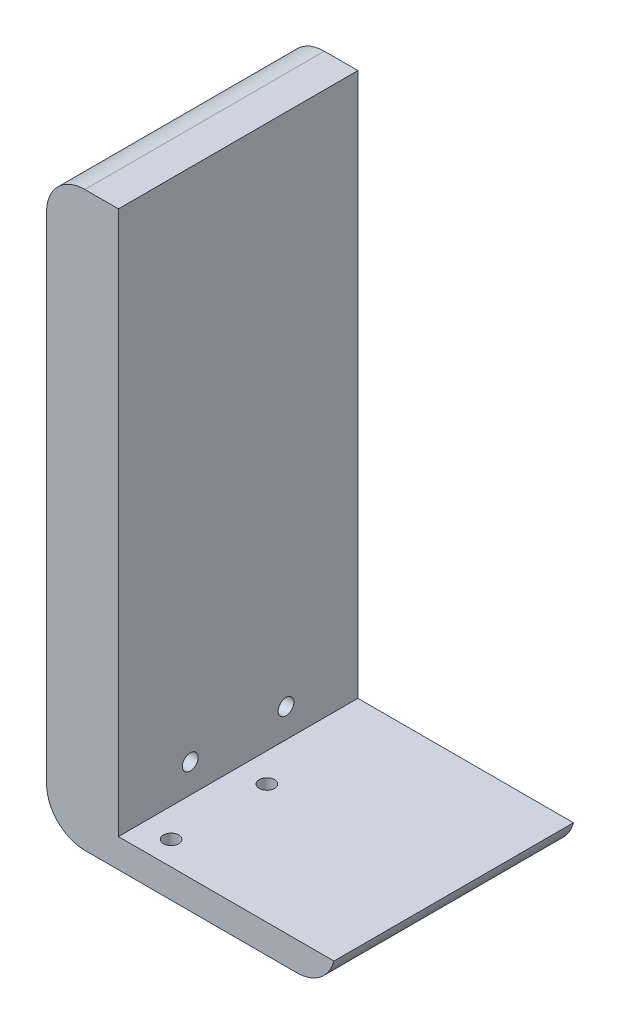
from build123d import *

# Parameters (mm, degrees)
EXTRUDE_1_DEPTH     = 25
FILLET_1_R          = 8
SKETCH_2_R          = 1.65
CUT_EXTRUDE_1_DEPTH = 137.034003102
SKETCH_3_R          = 1.6
CUT_EXTRUDE_2_DEPTH = 131.794686436


with BuildPart() as part:
    # 草图1 → 凸台-拉伸1 (new, symmetric)
    with BuildSketch(Plane.XY):
        Polygon((0, 0), (0, 119.5), (15, 119.5), (15, 6), (60, 6), (60, 0), align=None)
    extrude(amount=EXTRUDE_1_DEPTH, both=True)

    # 圆角1
    # the kernel refuses this fillet: 8 mm, written as the material it takes off along each edge
    with BuildSketch(Plane(origin=(0, 119.5, 45), x_dir=(0, -1, 0), z_dir=(0, 0, -1)), Plane(origin=(0, 0, -45), x_dir=(0, 1, 0), z_dir=(0, 0, 1))) as fillet_1_piece_1:
        with BuildLine():
            CenterArc((FILLET_1_R, -FILLET_1_R), FILLET_1_R, 90, 90)
            Line((0, -FILLET_1_R), (-FILLET_1_R * 0.02, -FILLET_1_R))
            Line((-FILLET_1_R * 0.02, -FILLET_1_R), (-FILLET_1_R * 0.02, FILLET_1_R * 0.02))
            Line((-FILLET_1_R * 0.02, FILLET_1_R * 0.02), (FILLET_1_R, FILLET_1_R * 0.02))
            Line((FILLET_1_R, FILLET_1_R * 0.02), (FILLET_1_R, 0))
        make_face()
    extrude(amount=90, mode=Mode.SUBTRACT)
    with BuildSketch(Plane(origin=(60, 0, -44.364916731), x_dir=(0, 1, 0), z_dir=(0, 0, 1))) as fillet_1_piece_2:
        with BuildLine():
            CenterArc((8, 7.745966692), FILLET_1_R, 180, 75.522487814)
            Line((0, 7.745966692), (-0.16, 7.745966692))
            Line((-0.16, 7.745966692), (-0.16, 0))
            Line((-0.16, 0), (0, -0.16))
            ThreePointArc((0, -0.16), (3, -0.16), (5.96, -0.154919334))
            Line((5.96, -0.154919334), (6, 0))
        make_face()
    extrude(amount=88.729833462, mode=Mode.SUBTRACT)

    # 草图2 → 切除-拉伸1 (cut, through all)
    with BuildSketch(Plane.ZY):
        with Locations((10, 12)):
            Circle(SKETCH_2_R)
        with Locations((-10, 12)):
            Circle(SKETCH_2_R)
    extrude(amount=-CUT_EXTRUDE_1_DEPTH, mode=Mode.SUBTRACT)

    # 草图3 → 切除-拉伸2 (cut, through all)
    with BuildSketch(Plane(origin=(0, 6, 0), x_dir=(1, 0, 0), z_dir=(0, 1, 0))):
        with Locations(Location((21, -20, 0), (0, 0, 270))):
            Circle(SKETCH_3_R)
        with Locations(Location((21, 0, 0), (0, 0, 270))):
            Circle(SKETCH_3_R)
    extrude(amount=-CUT_EXTRUDE_2_DEPTH, mode=Mode.SUBTRACT)


solid = part.part
